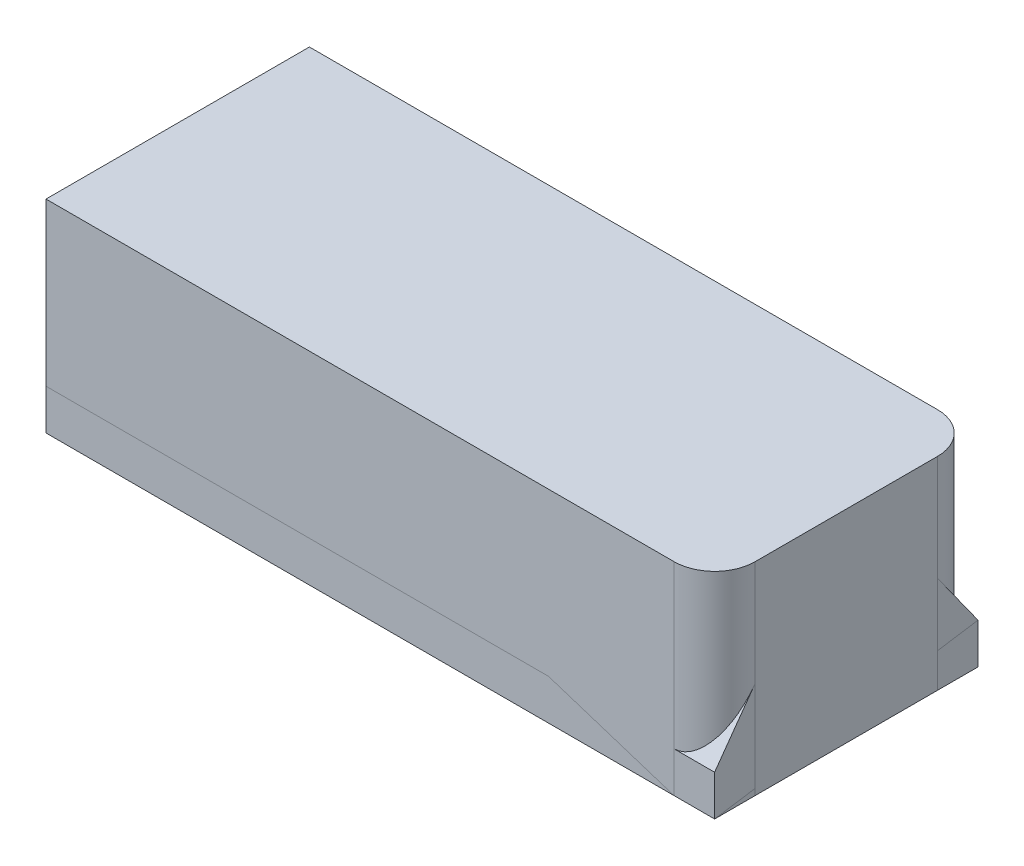
from build123d import *

# Parameters (mm, degrees)
BOSS_EXTRUDE1_DEPTH = 15.875
BOSS_EXTRUDE2_DEPTH = 20.6375
SKETCH3_R           = 0.79375
BOSS_EXTRUDE3_DEPTH = 52.3875


with BuildPart() as part:
    # Sketch1 → Boss-Extrude1 (new body)
    with BuildSketch(Plane(origin=(0, 0, 0), x_dir=(1, 0, 0), z_dir=(0, 1, 0))):
        with BuildLine():
            Line((0, 0), (0, 20.6375))
            Line((0, 20.6375), (49.2125, 20.6375))
            ThreePointArc((49.2125, 20.6375), (51.45756403, 19.70756403), (52.3875, 17.4625))
            Line((52.3875, 17.4625), (52.3875, 3.175))
            ThreePointArc((52.3875, 3.175), (51.45756403, 0.92993597), (49.2125, 0))
            Line((49.2125, 0), (0, 0))
        make_face()
    extrude(amount=BOSS_EXTRUDE1_DEPTH)


with BuildPart() as body_2:
    # Sketch2 → Boss-Extrude2 (new body)
    with BuildSketch(Plane.XY):
        Polygon((0, 0), (0, 3.175), (1.5875, 3.175), (1.5875, 15.875), (4.7625, 15.875), (4.7625, 3.175), (9.525, 3.175), (9.525, 15.875), (12.7, 15.875), (12.7, 3.175), (52.3875, 3.175), (52.3875, 0), align=None)
    extrude(amount=-BOSS_EXTRUDE2_DEPTH)


with BuildPart() as body_3:
    # Sketch3 → Boss-Extrude3 (new body)
    with BuildSketch(Plane(origin=(0, 0, 0), x_dir=(0, 0, -1), z_dir=(1, 0, 0))):
        with BuildLine():
            Line((0, 0), (0, 3.175))
            Line((0, 3.175), (8.38276104, 14.880219729))
            ThreePointArc((8.38276104, 14.880219729), (10.31875, 15.875), (12.25473896, 14.880219729))
            Line((12.25473896, 14.880219729), (20.6375, 3.175))
            Line((20.6375, 3.175), (20.6375, 0))
            Line((20.6375, 0), (0, 0))
        make_face()
        with Locations((10.31875, 13.49375)):
            Circle(SKETCH3_R, mode=Mode.SUBTRACT)
    extrude(amount=BOSS_EXTRUDE3_DEPTH)


solid = Compound([part.part, body_2.part, body_3.part])
